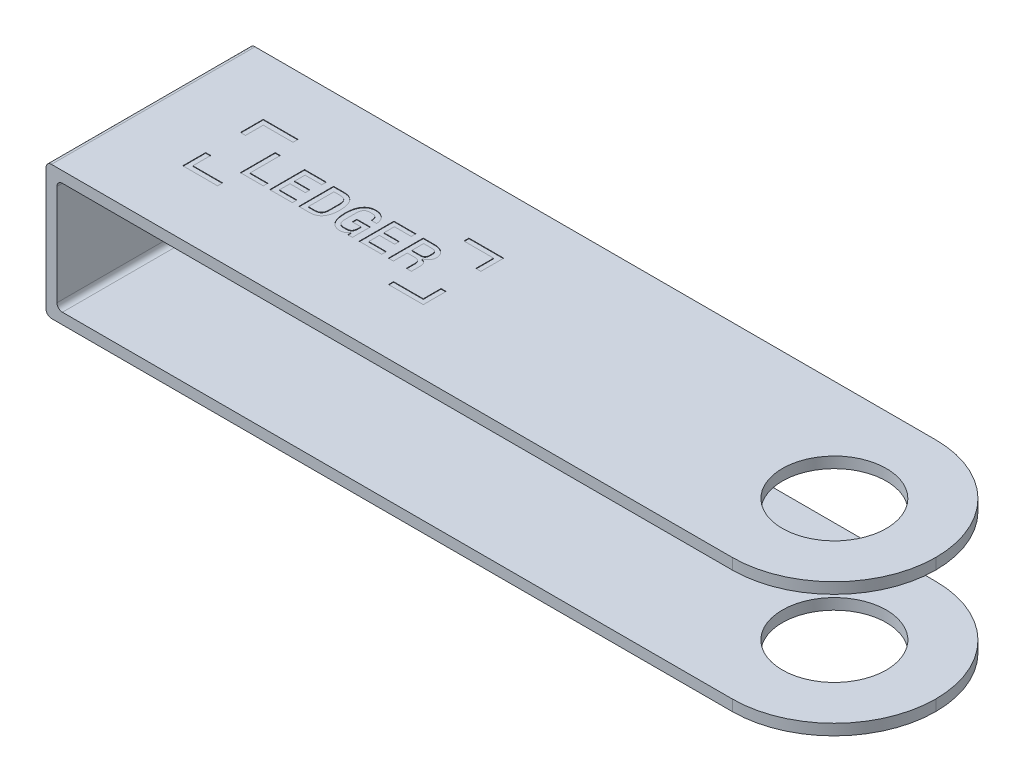
from build123d import *

# Parameters (mm, degrees)
BOSS_EXTRU_1_DEPTH      = 18.6
CONG_1_R                = 9.3
ESQUISSE2_R             = 4.75
ENL_V_MAT_EXTRU_1_DEPTH = 18.6
ENL_V_MAT_EXTRU_2_DEPTH = 0.05


with BuildPart() as part:
    # Esquisse1 → Boss.-Extru.1 (new body)
    with BuildSketch(Plane.XY):
        with BuildLine():
            Line((0.5, 0), (72, 0))
            Line((72, 0), (72, -1.000388631))
            Line((72, -1.000388631), (1.500989813, -1.000388631))
            ThreePointArc((1.500989813, -1.000388631), (1.147436423, -1.14683524), (1.000989813, -1.500388631))
            Line((1.000989813, -1.500388631), (1.000989813, -10.69980383))
            ThreePointArc((1.000989813, -10.69980383), (1.147436423, -11.053357221), (1.500989813, -11.19980383))
            Line((1.500989813, -11.19980383), (72, -11.19980383))
            Line((72, -11.19980383), (72, -12.2))
            Line((72, -12.2), (0.5, -12.2))
            ThreePointArc((0.5, -12.2), (0.146446609, -12.053553391), (0, -11.7))
            Line((0, -11.7), (0, -0.5))
            ThreePointArc((0, -0.5), (0.146446609, -0.146446609), (0.5, 0))
        make_face()
    extrude(amount=BOSS_EXTRU_1_DEPTH)

    # Congé1
    cong_1_edges = [part.edges().sort_by_distance(p)[0] for p in [
        (72, -11.699901915, 18.6),
        (72, -11.699901915, 0),
        (72, -0.500194315, 0),
        (72, -0.500194315, 18.6),
    ]]
    fillet(cong_1_edges, radius=CONG_1_R - 0.0001)  # a hair under: the kernel refuses the full size

    # Esquisse2 → Enlèv. mat.-Extru.1 (cut)
    with BuildSketch(Plane(origin=(0, 0, 0), x_dir=(1, 0, 0), z_dir=(0, 1, 0))):
        with Locations(Location((62.7, -9.271458817, 0), (0, 0, 270))):
            Circle(ESQUISSE2_R)
    extrude(amount=-ENL_V_MAT_EXTRU_1_DEPTH, mode=Mode.SUBTRACT)

    # Esquisse3 → Enlèv. mat.-Extru.2 (cut)
    # profile 1 of 10: a face of its own
    with BuildSketch(Plane(origin=(-8.003860477, 0, -2.356276682), x_dir=(1, 0, 0), z_dir=(0, 1, 0))):
        Polygon((36.124611123, -14.608551662), (33.411584123, -14.608551662), (33.411584123, -15.069889662), (36.589005123, -15.069889662), (36.589005123, -12.983178662), (36.124611123, -12.983178662), align=None)
    # profile 2 of 10: a face of its own
    with BuildSketch(Plane(origin=(-8.003860477, 0, -2.356276682), x_dir=(1, 0, 0), z_dir=(0, 1, 0))):
        Polygon((36.585949123, -7.719046662), (33.411584123, -7.719046662), (33.411584123, -8.180385662), (36.124611123, -8.180385662), (36.124611123, -9.805757662), (36.585949123, -9.805757662), align=None)
    # profile 3 of 10: a face of its own
    with BuildSketch(Plane(origin=(-8.003860477, 0, -2.356276682), x_dir=(1, 0, 0), z_dir=(0, 1, 0))):
        with BuildLine():
            add(Edge.make_bspline(
                [(33.225214123, -10.117389662), (33.008295123, -9.909635662), (32.718050123, -9.805757662), (32.339203123, -9.805757662)],
                knots=[0, 0, 0, 0, 1, 1, 1, 1], degree=3))
            Line((32.339203123, -9.805757662), (31.318764123, -9.805757662))
            Line((31.318764123, -9.805757662), (31.318764123, -12.983178662))
            Line((31.318764123, -12.983178662), (31.773990123, -12.983178662))
            Line((31.773990123, -12.983178662), (31.773990123, -11.715266662))
            Line((31.773990123, -11.715266662), (32.455303123, -11.715266662))
            add(Edge.make_bspline(
                [(32.455303123, -11.715266662), (32.803595123, -11.715266662), (32.944136123, -11.861916662), (32.944136123, -12.222430662)],
                knots=[0, 0, 0, 0, 1, 1, 1, 1], degree=3))
            Line((32.944136123, -12.222430662), (32.944136123, -12.980122662))
            Line((32.944136123, -12.980122662), (33.408528123, -12.980122662))
            Line((33.408528123, -12.980122662), (33.408528123, -12.295756662))
            add(Edge.make_bspline(
                [(33.408528123, -12.295756662), (33.408528123, -11.797755662), (33.289375123, -11.605278662), (32.928859123, -11.550285662)],
                knots=[0, 0, 0, 0, 1, 1, 1, 1], degree=3))
            Line((32.928859123, -11.550285662), (32.925803123, -11.489179662))
            add(Edge.make_bspline(
                [(32.925803123, -11.489179662), (33.255768123, -11.403634662), (33.487963123, -11.095058662), (33.487963123, -10.725377662)],
                knots=[0, 0, 0, 0, 1, 1, 1, 1], degree=3))
            add(Edge.make_bspline(
                [(33.487963123, -10.725377662), (33.487963123, -10.496235662), (33.393251123, -10.273204662), (33.225214123, -10.117389662)],
                knots=[0, 0, 0, 0, 1, 1, 1, 1], degree=3))
        make_face()
        with BuildLine():
            Line((32.501128123, -11.296700662), (31.773990123, -11.299756662))
            Line((31.773990123, -11.299756662), (31.773990123, -10.224323662))
            Line((31.773990123, -10.224323662), (32.501128123, -10.224323662))
            add(Edge.make_bspline(
                [(32.501128123, -10.224323662), (32.855535123, -10.224323662), (32.980797123, -10.343475662), (32.980797123, -10.664272662)],
                knots=[0, 0, 0, 0, 1, 1, 1, 1], degree=3))
            Line((32.980797123, -10.664272662), (32.980797123, -10.853695662))
            add(Edge.make_bspline(
                [(32.980797123, -10.853695662), (32.980797123, -11.183659662), (32.858589123, -11.296700662), (32.501128123, -11.296700662)],
                knots=[0, 0, 0, 0, 1, 1, 1, 1], degree=3))
        make_face(mode=Mode.SUBTRACT)
    # profile 4 of 10: a face of its own
    with BuildSketch(Plane(origin=(-8.003860477, 0, -2.356276682), x_dir=(1, 0, 0), z_dir=(0, 1, 0))):
        Polygon((29.103733123, -12.564615662), (29.103733123, -11.596113662), (30.503022123, -11.596113662), (30.503022123, -11.177548662), (29.103733123, -11.177548662), (29.103733123, -10.224323662), (30.637451123, -10.224323662), (30.637451123, -9.805757662), (28.642397123, -9.805757662), (28.642397123, -12.983178662), (30.707719123, -12.983178662), (30.707719123, -12.564615662), align=None)
    # profile 5 of 10: a face of its own
    with BuildSketch(Plane(origin=(-8.003860477, 0, -2.356276682), x_dir=(1, 0, 0), z_dir=(0, 1, 0))):
        with BuildLine():
            Line((26.793994123, -11.764147662), (27.585294123, -11.764147662))
            Line((27.585294123, -11.764147662), (27.585294123, -11.978013662))
            add(Edge.make_bspline(
                [(27.585294123, -11.978013662), (27.585294123, -12.436295662), (27.417258123, -12.586001662), (26.995639123, -12.586001662)],
                knots=[0, 0, 0, 0, 1, 1, 1, 1], degree=3))
            Line((26.995639123, -12.586001662), (26.894817123, -12.586001662))
            add(Edge.make_bspline(
                [(26.894817123, -12.586001662), (26.473195123, -12.586001662), (26.268498123, -12.448516662), (26.268498123, -11.819144662)],
                knots=[0, 0, 0, 0, 1, 1, 1, 1], degree=3))
            Line((26.268498123, -11.819144662), (26.268498123, -10.966738662))
            add(Edge.make_bspline(
                [(26.268498123, -10.966738662), (26.268498123, -10.331254662), (26.482363123, -10.199880662), (26.903982123, -10.199880662)],
                knots=[0, 0, 0, 0, 1, 1, 1, 1], degree=3))
            Line((26.903982123, -10.199880662), (26.995639123, -10.199880662))
            add(Edge.make_bspline(
                [(26.995639123, -10.199880662), (27.408090123, -10.199880662), (27.539466123, -10.352640662), (27.545575123, -10.780371662)],
                knots=[0, 0, 0, 0, 1, 1, 1, 1], degree=3))
            Line((27.545575123, -10.780371662), (28.043574123, -10.780371662))
            add(Edge.make_bspline(
                [(28.043574123, -10.780371662), (27.997748123, -10.154052662), (27.582238123, -9.759929662), (26.955919123, -9.759929662)],
                knots=[0, 0, 0, 0, 1, 1, 1, 1], degree=3))
            add(Edge.make_bspline(
                [(26.955919123, -9.759929662), (26.650397123, -9.759929662), (26.396815123, -9.854641662), (26.207392123, -10.037953662)],
                knots=[0, 0, 0, 0, 1, 1, 1, 1], degree=3))
            add(Edge.make_bspline(
                [(26.207392123, -10.037953662), (25.920203123, -10.306812662), (25.764387123, -10.758985662), (25.764387123, -11.394469662)],
                knots=[0, 0, 0, 0, 1, 1, 1, 1], degree=3))
            add(Edge.make_bspline(
                [(25.764387123, -11.394469662), (25.764387123, -12.005511662), (25.901872123, -12.460737662), (26.182950123, -12.741817662)],
                knots=[0, 0, 0, 0, 1, 1, 1, 1], degree=3))
            add(Edge.make_bspline(
                [(26.182950123, -12.741817662), (26.375429123, -12.925128662), (26.629011123, -13.029007662), (26.894817123, -13.029007662)],
                knots=[0, 0, 0, 0, 1, 1, 1, 1], degree=3))
            add(Edge.make_bspline(
                [(26.894817123, -13.029007662), (27.166729123, -13.029007662), (27.417258123, -12.919019662), (27.542519123, -12.683768662)],
                knots=[0, 0, 0, 0, 1, 1, 1, 1], degree=3))
            Line((27.542519123, -12.683768662), (27.606681123, -12.683768662))
            Line((27.606681123, -12.683768662), (27.606681123, -12.986234662))
            Line((27.606681123, -12.986234662), (28.025244123, -12.986234662))
            Line((28.025244123, -12.986234662), (28.025244123, -11.348640662))
            Line((28.025244123, -11.348640662), (26.793994123, -11.348640662))
            Line((26.793994123, -11.348640662), (26.793994123, -11.764147662))
        make_face()
    # profile 6 of 10: a face of its own
    with BuildSketch(Plane(origin=(-8.003860477, 0, -2.356276682), x_dir=(1, 0, 0), z_dir=(0, 1, 0))):
        with BuildLine():
            add(Edge.make_bspline(
                [(25.306105123, -11.394469662), (25.306105123, -10.450406662), (24.960866123, -9.805757662), (24.108462123, -9.805757662)],
                knots=[0, 0, 0, 0, 1, 1, 1, 1], degree=3))
            Line((24.108462123, -9.805757662), (23.127739123, -9.805757662))
            Line((23.127739123, -9.805757662), (23.127739123, -12.983178662))
            Line((23.127739123, -12.983178662), (24.117628123, -12.983178662))
            add(Edge.make_bspline(
                [(24.117628123, -12.983178662), (24.985308123, -12.983178662), (25.306105123, -12.326308662), (25.306105123, -11.394469662)],
                knots=[0, 0, 0, 0, 1, 1, 1, 1], degree=3))
        make_face()
        with BuildLine():
            Line((23.582966123, -12.564615662), (23.582966123, -10.224323662))
            Line((23.582966123, -10.224323662), (24.077910123, -10.224323662))
            add(Edge.make_bspline(
                [(24.077910123, -10.224323662), (24.545357123, -10.224323662), (24.798940123, -10.343475662), (24.798940123, -10.975903662)],
                knots=[0, 0, 0, 0, 1, 1, 1, 1], degree=3))
            Line((24.798940123, -10.975903662), (24.798940123, -11.809976662))
            add(Edge.make_bspline(
                [(24.798940123, -11.809976662), (24.798940123, -12.445460662), (24.545357123, -12.564615662), (24.077910123, -12.564615662)],
                knots=[0, 0, 0, 0, 1, 1, 1, 1], degree=3))
            Line((24.077910123, -12.564615662), (23.582966123, -12.564615662))
        make_face(mode=Mode.SUBTRACT)
    # profile 7 of 10: a face of its own
    with BuildSketch(Plane(origin=(-8.003860477, 0, -2.356276682), x_dir=(1, 0, 0), z_dir=(0, 1, 0))):
        Polygon((20.937152123, -12.564615662), (20.937152123, -11.596113662), (22.336439123, -11.596113662), (22.336439123, -11.177548662), (20.937152123, -11.177548662), (20.937152123, -10.224323662), (22.470868123, -10.224323662), (22.470868123, -9.805757662), (20.472760123, -9.805757662), (20.472760123, -12.983178662), (22.538083123, -12.983178662), (22.538083123, -12.564615662), align=None)
    # profile 8 of 10: a face of its own
    with BuildSketch(Plane(origin=(-8.003860477, 0, -2.356276682), x_dir=(1, 0, 0), z_dir=(0, 1, 0))):
        Polygon((18.257731123, -12.564615662), (18.257731123, -9.805757662), (17.793339123, -9.805757662), (17.793339123, -12.983178662), (19.880048123, -12.983178662), (19.880048123, -12.564615662), align=None)
    # profile 9 of 10: a face of its own
    with BuildSketch(Plane(origin=(-8.003860477, 0, -2.356276682), x_dir=(1, 0, 0), z_dir=(0, 1, 0))):
        Polygon((14.615918123, -12.980122662), (14.615918123, -12.983178662), (14.615918123, -15.069889662), (17.793339123, -15.069889662), (17.793339123, -14.605495662), (15.077255123, -14.605495662), (15.077255123, -12.980122662), align=None)
    # profile 10 of 10: a face of its own
    with BuildSketch(Plane(origin=(-8.003860477, 0, -2.356276682), x_dir=(1, 0, 0), z_dir=(0, 1, 0))):
        Polygon((17.790283123, -7.719046662), (14.615918123, -7.719046662), (14.615918123, -9.805757662), (15.077255123, -9.805757662), (15.077255123, -8.180385662), (17.790283123, -8.180385662), align=None)
    extrude(amount=-ENL_V_MAT_EXTRU_2_DEPTH, mode=Mode.SUBTRACT)


solid = part.part
